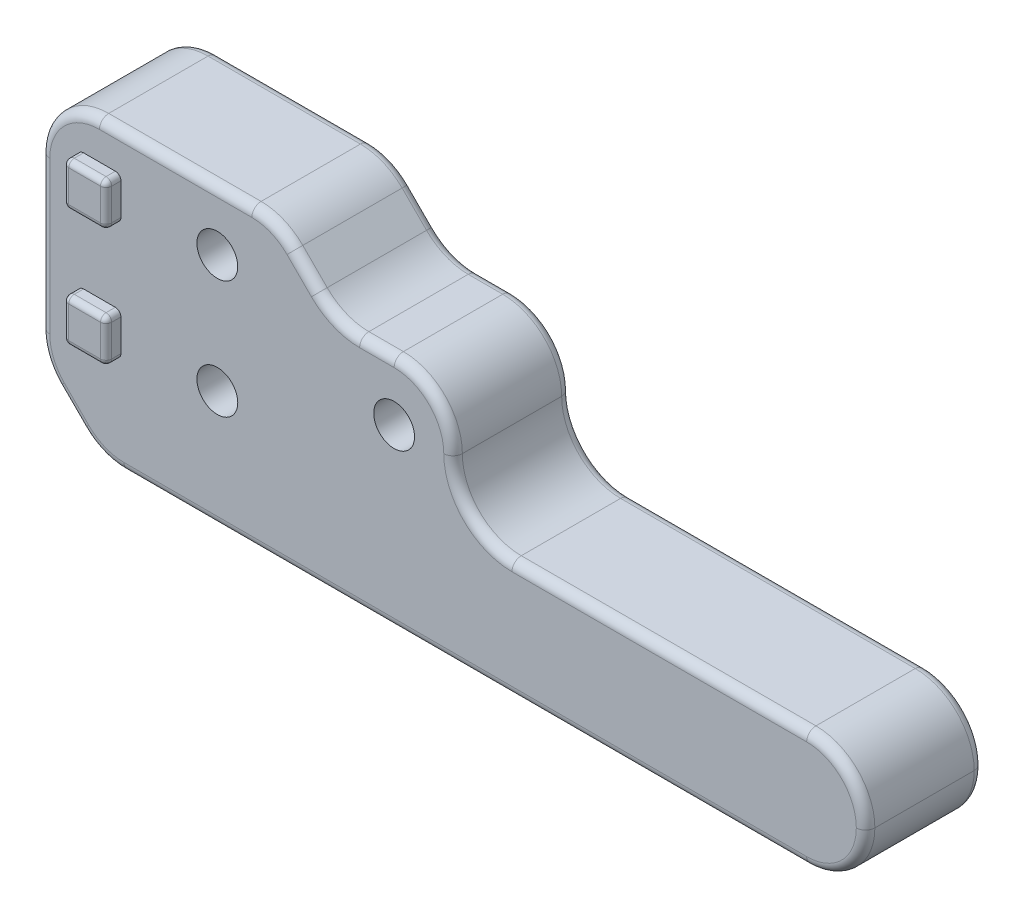
from build123d import *

# Parameters (mm, degrees)
SKETCH1_R           = 2.2
SKETCH1_W           = 25.4
SKETCH1_H           = 25.4
SKETCH1_W_2         = 4.6228
SKETCH1_H_2         = 4.6228
SKETCH1_W_3         = 12.7
SKETCH1_H_3         = 12.7
BOSS_EXTRUDE1_DEPTH = 12.7
BOSS_EXTRUDE2_START = 12.7
SKETCH1_3_W         = 4.6228
SKETCH1_3_H         = 4.6228
BOSS_EXTRUDE2_DEPTH = 1.6
FILLET1_R           = 6.35
FILLET2_R           = 0.6
FILLET3_R           = 1


with BuildPart() as part:
    # Sketch1 → Boss-Extrude1 (new body)
    # profile 1 of 5: a face of its own
    with BuildSketch(Plane.XY):
        Polygon((6.35, -31.75), (0, -25.4), (25.4, -25.4), (25.4, 0), (31.75, -6.35), (44.45, -6.35), (44.45, -19.05), (76.2, -19.05), (76.2, -31.75), align=None)
        with Locations((38.1, -12.7)):
            Circle(SKETCH1_R, mode=Mode.SUBTRACT)
    # profile 2 of 5: a face of its own
    with BuildSketch(Plane.XY):
        with Locations((12.7, -12.7)):
            Rectangle(SKETCH1_W, SKETCH1_H)
        with Locations((19.05, -19.05)):
            Circle(SKETCH1_R, mode=Mode.SUBTRACT)
        with Locations((19.05, -6.35)):
            Circle(SKETCH1_R, mode=Mode.SUBTRACT)
        with Locations((6.35, -6.35)):
            Rectangle(SKETCH1_W_2, SKETCH1_H_2, mode=Mode.SUBTRACT)
        with Locations((6.35, -19.05)):
            Rectangle(SKETCH1_W_2, SKETCH1_H_2, mode=Mode.SUBTRACT)
    # profile 3 of 5: a face of its own
    with BuildSketch(Plane.XY):
        with Locations((6.35, -19.05)):
            Rectangle(SKETCH1_W_2, SKETCH1_H_2)
    # profile 4 of 5: a face of its own
    with BuildSketch(Plane.XY):
        with Locations((6.35, -6.35)):
            Rectangle(SKETCH1_W_2, SKETCH1_H_2)
    # profile 5 of 5: a face of its own
    with BuildSketch(Plane.XY):
        with Locations((82.55, -25.4)):
            Rectangle(SKETCH1_W_3, SKETCH1_H_3)
    extrude(amount=BOSS_EXTRUDE1_DEPTH)

    # Sketch1<3> → Boss-Extrude2 (add)
    with BuildSketch(Plane.XY.offset(BOSS_EXTRUDE2_START)):
        with Locations((6.35, -6.35)):
            Rectangle(SKETCH1_3_W, SKETCH1_3_H)
        with Locations((6.35, -19.05)):
            Rectangle(SKETCH1_3_W, SKETCH1_3_H)
    extrude(amount=BOSS_EXTRUDE2_DEPTH)

    # Fillet1
    fillet1_edges = [part.edges().sort_by_distance(p)[0] for p in [
        (88.9, -31.75, 6.35),
        (88.9, -19.05, 6.35),
        (44.45, -19.05, 6.35),
        (44.45, -6.35, 6.35),
        (31.75, -6.35, 6.35),
        (25.4, 0, 6.35),
        (6.35, -31.75, 6.35),
        (0, -25.4, 6.35),
        (0, 0, 6.35),
    ]]
    fillet(fillet1_edges, radius=FILLET1_R - 0.0001)  # a hair under: the kernel refuses the full size

    # Fillet2
    fillet2_edges = [part.edges().sort_by_distance(p)[0] for p in [
        (6.35, -8.6614, 14.3),
        (4.0386, -8.6614, 13.5),
        (8.6614, -8.6614, 13.5),
        (8.6614, -4.0386, 13.5),
        (4.0386, -6.35, 14.3),
        (4.0386, -4.0386, 13.5),
        (8.6614, -6.35, 14.3),
        (6.35, -4.0386, 14.3),
        (6.35, -21.3614, 14.3),
        (4.0386, -21.3614, 13.5),
        (8.6614, -21.3614, 13.5),
        (8.6614, -16.7386, 13.5),
        (4.0386, -19.05, 14.3),
        (4.0386, -16.7386, 13.5),
        (8.6614, -19.05, 14.3),
        (6.35, -16.7386, 14.3),
    ]]
    fillet(fillet2_edges, radius=FILLET2_R)

    # Fillet3
    fillet3_edges = [part.edges().sort_by_distance(p)[0] for p in [
        (3.175, -28.575, 0),
        (0, -14.55984265, 0),
        (14.55984265, 0, 0),
        (28.575, -3.175, 0),
        (36.24015735, -6.35, 0),
        (66.675, -19.05, 0),
        (45.76515735, -31.75, 0),
        (1.85984265, -1.85984265, 0),
        (0.483357357, -25.199786827, 0),
        (6.550213173, -31.266642643, 0),
        (25.199786827, -0.483357357, 0),
        (42.59015735, -8.20984265, 0),
        (87.04015735, -20.90984265, 0),
        (87.04015735, -29.89015735, 0),
        (45.76515735, -31.75, 12.7),
        (3.175, -28.575, 12.7),
        (66.675, -19.05, 12.7),
        (36.24015735, -6.35, 12.7),
        (28.575, -3.175, 12.7),
        (14.55984265, 0, 12.7),
        (0, -14.55984265, 12.7),
        (1.85984265, -1.85984265, 12.7),
        (0.483357357, -25.199786827, 12.7),
        (6.550213173, -31.266642643, 12.7),
        (25.199786827, -0.483357357, 12.7),
        (42.59015735, -8.20984265, 12.7),
        (87.04015735, -20.90984265, 12.7),
        (87.04015735, -29.89015735, 12.7),
        (46.30984265, -17.19015735, 0),
        (46.30984265, -17.19015735, 12.7),
        (31.950213173, -5.866642643, 0),
        (31.950213173, -5.866642643, 12.7),
    ]]
    fillet(fillet3_edges, radius=FILLET3_R)


solid = part.part
